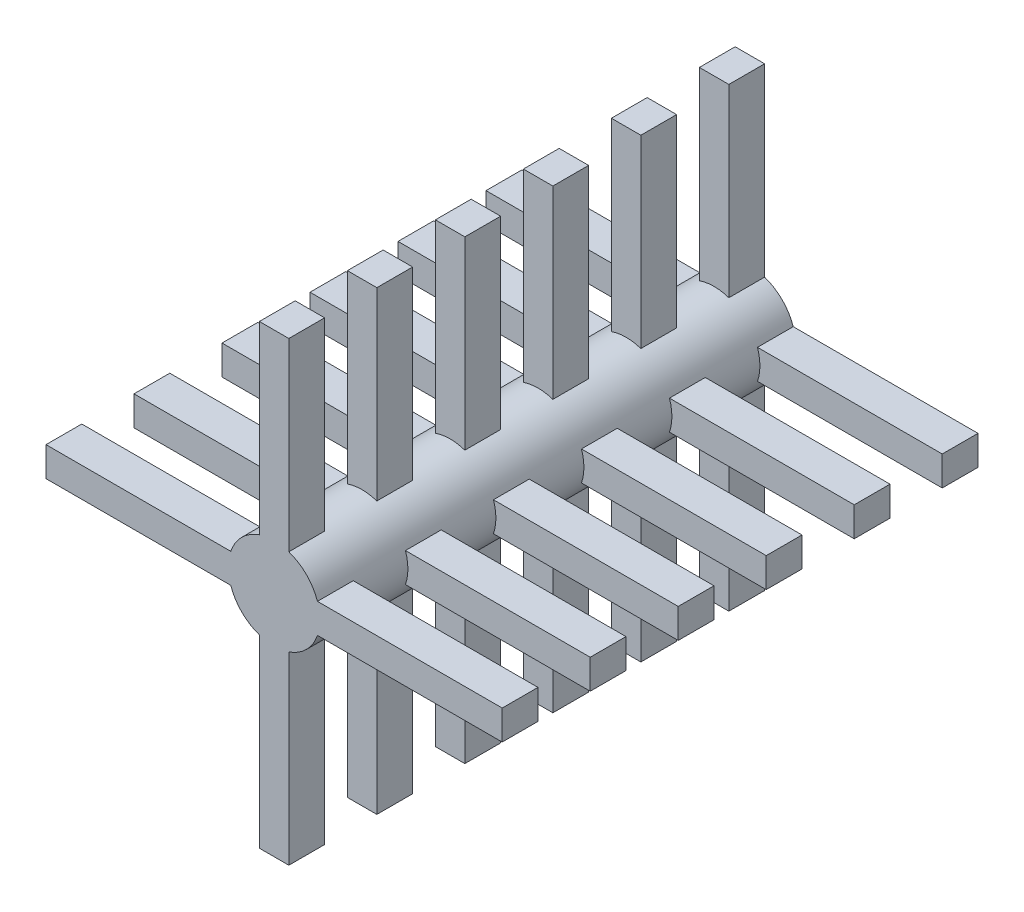
from build123d import *

# Parameters (mm, degrees)
BOSS_EXTRUDE1_DEPTH = 133
BOSS_EXTRUDE2_DEPTH = 10
LPATTERN1_COUNT     = 6
LPATTERN1_PITCH     = 24.6


with BuildPart() as part:
    # Sketch1 → Boss-Extrude1 (new body)
    with BuildSketch(Plane.XY):
        with BuildLine():
            ThreePointArc((12.115943321, 4.118512025), (9.048707749, 9.048707749), (4.118512025, 12.115943321))
            ThreePointArc((4.118512025, 12.115943321), (0, 12.796805221), (-4.118512025, 12.115943321))
            ThreePointArc((-4.118512025, 12.115943321), (-9.048707749, 9.048707749), (-12.115943321, 4.118512025))
            ThreePointArc((-12.115943321, 4.118512025), (-12.796805221, 0), (-12.115943321, -4.118512025))
            ThreePointArc((-12.115943321, -4.118512025), (-9.048707749, -9.048707749), (-4.118512025, -12.115943321))
            ThreePointArc((-4.118512025, -12.115943321), (0, -12.796805221), (4.118512025, -12.115943321))
            ThreePointArc((4.118512025, -12.115943321), (9.048707749, -9.048707749), (12.115943321, -4.118512025))
            ThreePointArc((12.115943321, -4.118512025), (12.62544238, -2.087205921), (12.796805221, 0))
            ThreePointArc((12.796805221, 0), (12.62544238, 2.087205921), (12.115943321, 4.118512025))
        make_face()
    extrude(amount=BOSS_EXTRUDE1_DEPTH)

    # Sketch1<3> → Boss-Extrude2 (add)
    with BuildSketch(Plane.XY):
        with BuildLine():
            ThreePointArc((-4.118512025, 12.115943321), (0, 12.796805221), (4.118512025, 12.115943321))
            Line((4.118512025, 12.115943321), (4.118512025, 63.763391531))
            Line((4.118512025, 63.763391531), (-4.118512025, 63.763391531))
            Line((-4.118512025, 63.763391531), (-4.118512025, 12.115943321))
        make_face()
        with BuildLine():
            Line((63.763391531, 4.118512025), (12.115943321, 4.118512025))
            ThreePointArc((12.115943321, 4.118512025), (12.796805221, 0), (12.115943321, -4.118512025))
            Line((12.115943321, -4.118512025), (63.763391531, -4.118512025))
            Line((63.763391531, -4.118512025), (63.763391531, 4.118512025))
        make_face()
        with BuildLine():
            ThreePointArc((-12.115943321, -4.118512025), (-12.796805221, 0), (-12.115943321, 4.118512025))
            Line((-12.115943321, 4.118512025), (-63.763391531, 4.118512025))
            Line((-63.763391531, 4.118512025), (-63.763391531, -4.118512025))
            Line((-63.763391531, -4.118512025), (-12.115943321, -4.118512025))
        make_face()
        with BuildLine():
            Line((4.118512025, -63.763391531), (4.118512025, -12.115943321))
            ThreePointArc((4.118512025, -12.115943321), (0, -12.796805221), (-4.118512025, -12.115943321))
            Line((-4.118512025, -12.115943321), (-4.118512025, -63.763391531))
            Line((-4.118512025, -63.763391531), (4.118512025, -63.763391531))
        make_face()
    boss_extrude2 = extrude(amount=BOSS_EXTRUDE2_DEPTH)

    # LPattern1: Boss-Extrude2 ×6
    with Locations(*[(0, 0, i * LPATTERN1_PITCH) for i in range(1, LPATTERN1_COUNT)]):
        add(boss_extrude2)


solid = part.part
